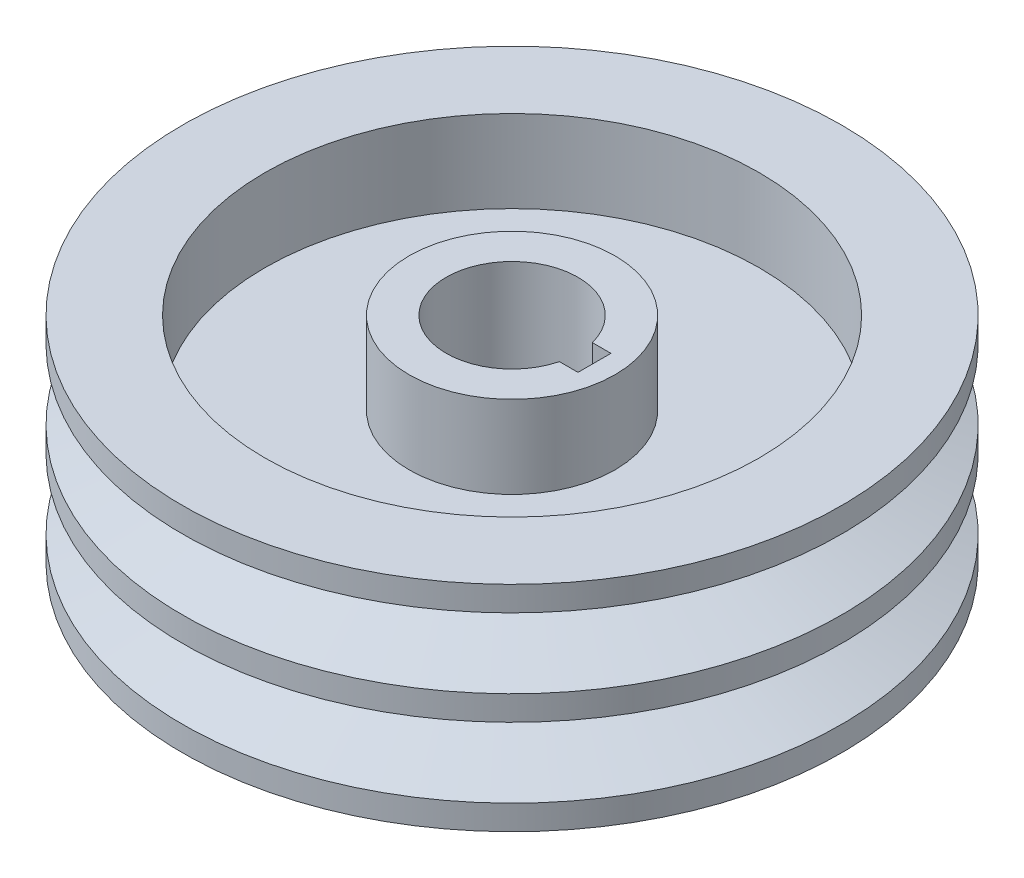
from build123d import *

# Parameters (mm, degrees)
SKETCH_2_W          = 10
SKETCH_2_H          = 4
CUT_EXTRUDE_1_DEPTH = 63.257529665


with BuildPart() as part:
    # 草圖1 → 旋轉1 (revolve)
    with BuildSketch(Plane.XY):
        Polygon((30, -13), (30, -3), (12.5, -3), (12.5, -13), (8, -13), (8, 13), (12.5, 13), (12.5, 3), (30, 3), (30, 13), (40, 13), (40, 10), (32, 7.088238126), (32, 4.411761874), (40, 1.5), (40, -1.5), (32, -4.411761874), (32, -7.088238126), (40, -10), (40, -13), align=None)
    revolve(axis=Axis((0, 0, 0), (0, 1, 0)))

    # 草圖2 → 除料-伸長1 (cut, through all)
    with BuildSketch(Plane(origin=(0, 13, 0), x_dir=(1, 0, 0), z_dir=(0, 1, 0))):
        with Locations((5, 0)):
            Rectangle(SKETCH_2_W, SKETCH_2_H)
    extrude(amount=-CUT_EXTRUDE_1_DEPTH, mode=Mode.SUBTRACT)


solid = part.part
